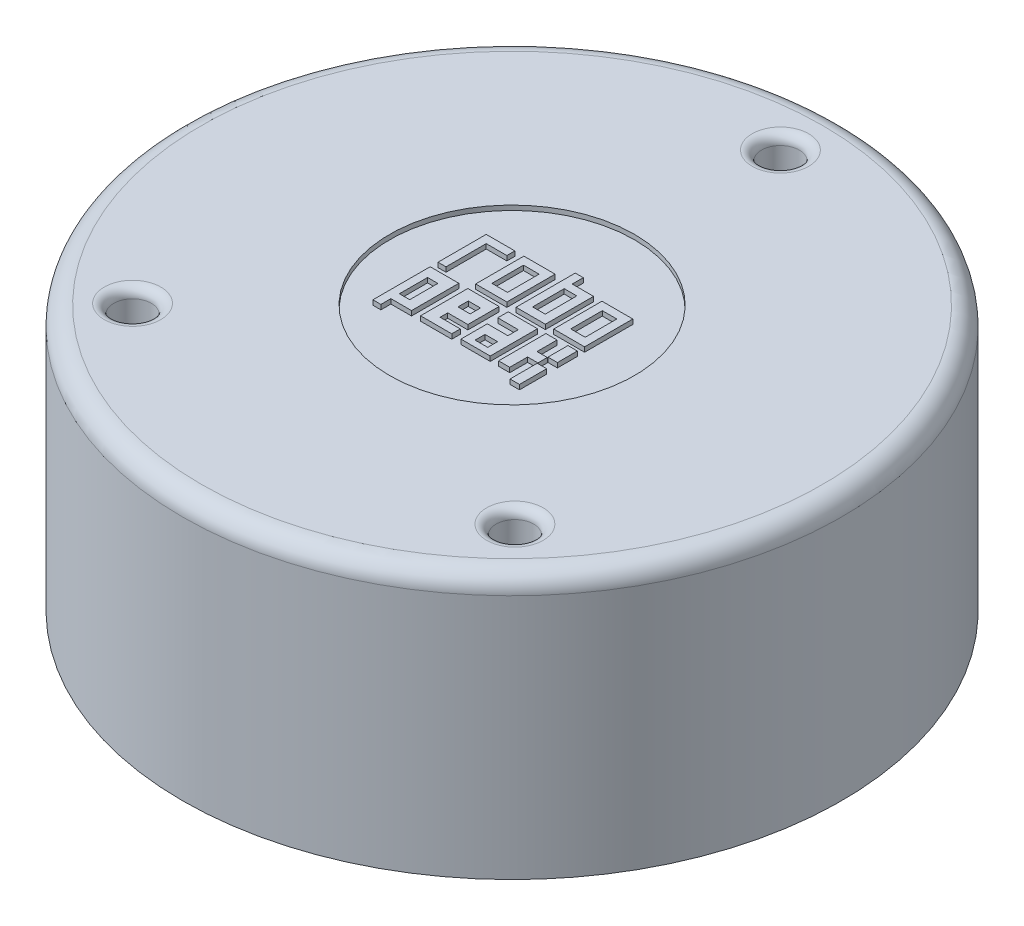
from build123d import *

# Parameters (mm, degrees)
SKETCH_1_W              = 98.5
SKETCH_1_H              = 70
EXTRUDE_1_DEPTH         = 5
SKETCH_2_R              = 35
EXTRUDE_2_DEPTH         = 28.1
SKETCH_3_R              = 2
CUT_EXTRUDE_1_DEPTH     = 5
FILLET_1_R              = 2
FILLET_2_R              = 1
SKETCH_4_R              = 13
SKETCH_4_W              = 3.316540618
SKETCH_4_H              = 5.120069114
SKETCH_4_W_2            = 3.276095001
SKETCH_4_W_3            = 1.001370982
SKETCH_4_H_2            = 2.121481923
SKETCH_4_H_3            = 2.893302243
SKETCH_4_W_4            = 1.096399653
SKETCH_4_H_4            = 2.99297568
SKETCH_4_W_5            = 1.536933457
SKETCH_4_H_5            = 3.356986235
SKETCH_4_W_6            = 1.658270309
SKETCH_4_W_7            = 1.334705371
SKETCH_4_H_6            = 1.05158605
SKETCH_4_W_8            = 1.294259754
SKETCH_4_H_7            = 1.092031667
CUT_EXTRUDE_3_DEPTH     = 0.5
SKETCH_5_R              = 1.25
CUT_EXTRUDE_4_DEPTH     = 5
SKETCH_6_R              = 9
EXTRUDE_3_DEPTH         = 7
CUT_EXTRUDE_START       = -1
SKETCH_7_R              = 9
SKETCH_7_R_2            = 0.99350654
CUT_EXTRUDE_5_DEPTH     = 1
SKETCH_8_R              = 5.521677929
SKETCH_8_R_2            = 3.001097475
CUT_EXTRUDE_6_DEPTH     = 1
FILLET_3_R              = 0.4
SKETCH_9_R              = 16
EXTRUDE_4_DEPTH         = 27
EXTRUDE_5_DEPTH         = 38
SKETCH_11_R             = 26
EXTRUDE_6_DEPTH         = 8
FILLET_4_R              = 1
SKETCH_12_W             = 106.251501727
SKETCH_12_H             = 75.565901032
CUT_EXTRUDE_7_DEPTH     = 8
FILLET_5_R              = 100
EXTRUDE_START           = 8
EXTRUDE_7_DEPTH         = 1.6
SKETCH_14_W             = 20
SKETCH_14_H             = 5
EXTRUDE_8_DEPTH         = 6
CHAMFER_1_SIZE          = 1
CUT_EXTRUDE2_DEPTH      = 72.379972525
CUT_EXTRUDE2_DEPTH_BACK = 72.379972525
SKETCH2_W               = 111.591182267
SKETCH2_H               = 43
SKETCH3_R               = 9
CUT_EXTRUDE3_DEPTH      = 10


with BuildPart() as part:
    # Эскиз1 → Бобышка-Вытянуть1 (new body)
    with BuildSketch(Plane(origin=(0, 0, 0), x_dir=(1, 0, 0), z_dir=(0, 1, 0))):
        Rectangle(SKETCH_1_W, SKETCH_1_H)
    extrude(amount=EXTRUDE_1_DEPTH)

    # Эскиз2 → Бобышка-Вытянуть2 (add)
    with BuildSketch(Plane(origin=(0, 5, 0), x_dir=(1, 0, 0), z_dir=(0, 1, 0))):
        with Locations(Location((-14.25, 0, 0), (0, 0, 270))):
            Circle(SKETCH_2_R)
    extrude(amount=EXTRUDE_2_DEPTH)

    # Эскиз3 → Вырез-Вытянуть1 (cut)
    with BuildSketch(Plane(origin=(0, 33.1, 0), x_dir=(1, 0, 0), z_dir=(0, 1, 0))):
        with Locations(Location((-14.25, 28.5, 0), (0, 0, 270))):
            Circle(SKETCH_3_R)
        with Locations(Location((-34.553940504, -20, 0), (0, 0, 270))):
            Circle(SKETCH_3_R)
        with Locations(Location((6.053940504, -20, 0), (0, 0, 270))):
            Circle(SKETCH_3_R)
    extrude(amount=-CUT_EXTRUDE_1_DEPTH, mode=Mode.SUBTRACT)

    # Скругление1
    fillet_1_edges = [part.edges().sort_by_distance(p)[0] for p in [
        (-14.25, 33.1, -35),
    ]]
    fillet(fillet_1_edges, radius=FILLET_1_R)

    # Скругление2
    fillet_2_edges = [part.edges().sort_by_distance(p)[0] for p in [
        (-14.25, 33.1, -30.5),
        (-34.553940504, 33.1, 18),
        (6.053940504, 33.1, 18),
    ]]
    fillet(fillet_2_edges, radius=FILLET_2_R)

    # Эскиз4 → Вырез-Вытянуть3 (cut)
    # profile 1 of 7: a face of its own
    with BuildSketch(Plane(origin=(0, 33.1, 0), x_dir=(1, 0, 0), z_dir=(0, 1, 0))):
        with Locations(Location((-14.25, 0, 0), (0, 0, 270))):
            Circle(SKETCH_4_R)
        Polygon((-22.115166942, -6.914876839), (-22.115166942, -0.831627154), (-19.0735421, -0.831627154), (-19.0735421, -5.853844917), (-21.266341405, -5.853844917), (-21.266341405, -6.914876839), align=None, mode=Mode.SUBTRACT)
        Polygon((-22.115166942, 0), (-22.115166942, 5.120069114), (-19.0735421, 5.120069114), (-19.0735421, 4.27071115), (-21.266341405, 4.27071115), (-21.266341405, 0), align=None, mode=Mode.SUBTRACT)
        Polygon((-13.829606569, 0), (-13.829606569, 6.292992015), (-12.980248606, 6.292992015), (-12.980248606, 5.120069114), (-10.715294037, 5.120069114), (-10.715294037, 0), align=None, mode=Mode.SUBTRACT)
        with Locations((-16.458571693, 2.560034557)):
            Rectangle(SKETCH_4_W, SKETCH_4_H, mode=Mode.SUBTRACT)
        with Locations((-8.187442955, 2.560034557)):
            Rectangle(SKETCH_4_W_2, SKETCH_4_H, mode=Mode.SUBTRACT)
        with Locations((-7.050080946, -1.825090787)):
            Rectangle(SKETCH_4_W_3, SKETCH_4_H_2, mode=Mode.SUBTRACT)
        with Locations((-7.050080946, -5.468225718)):
            Rectangle(SKETCH_4_W_3, SKETCH_4_H_3, mode=Mode.SUBTRACT)
        Polygon((-9.825490456, -0.831627154), (-8.643651064, -0.831627154), (-8.643651064, -2.960833634), (-7.550766437, -2.960833634), (-7.550766437, -3.957287265), (-8.643651064, -3.957287265), (-8.643651064, -5.853844917), (-9.825490456, -5.853844917), align=None, mode=Mode.SUBTRACT)
        Polygon((-13.829606569, -0.831627154), (-10.715294037, -0.831627154), (-10.715294037, -5.853844917), (-13.829606569, -5.853844917), (-13.829606569, -3.04994558), (-11.645543235, -3.04994558), (-11.645543235, -1.940786367), (-13.829606569, -1.940786367), align=None, mode=Mode.SUBTRACT)
        Polygon((-18.116842002, -0.831627154), (-14.800301384, -0.831627154), (-14.800301384, -4.141977247), (-16.943919101, -4.141977247), (-16.943919101, -4.950889593), (-14.800301384, -4.950889593), (-14.800301384, -5.853844917), (-18.116842002, -5.853844917), align=None, mode=Mode.SUBTRACT)
    # profile 2 of 7: a face of its own
    with BuildSketch(Plane(origin=(0, 33.1, 0), x_dir=(1, 0, 0), z_dir=(0, 1, 0))):
        with Locations((-20.718141579, -3.454401753)):
            Rectangle(SKETCH_4_W_4, SKETCH_4_H_4)
    # profile 3 of 7: a face of its own
    with BuildSketch(Plane(origin=(0, 33.1, 0), x_dir=(1, 0, 0), z_dir=(0, 1, 0))):
        with Locations((-8.167220148, 2.592218033)):
            Rectangle(SKETCH_4_W_5, SKETCH_4_H_5)
    # profile 4 of 7: a face of its own
    with BuildSketch(Plane(origin=(0, 33.1, 0), x_dir=(1, 0, 0), z_dir=(0, 1, 0))):
        with Locations((-16.478794502, 2.592218033)):
            Rectangle(SKETCH_4_W_6, SKETCH_4_H_5)
    # profile 5 of 7: a face of its own
    with BuildSketch(Plane(origin=(0, 33.1, 0), x_dir=(1, 0, 0), z_dir=(0, 1, 0))):
        with Locations((-12.312895921, 2.592218033)):
            Rectangle(SKETCH_4_W_7, SKETCH_4_H_5)
    # profile 6 of 7: a face of its own
    with BuildSketch(Plane(origin=(0, 33.1, 0), x_dir=(1, 0, 0), z_dir=(0, 1, 0))):
        with Locations((-12.312895921, -4.667770272)):
            Rectangle(SKETCH_4_W_7, SKETCH_4_H_6)
    # profile 7 of 7: a face of its own
    with BuildSketch(Plane(origin=(0, 33.1, 0), x_dir=(1, 0, 0), z_dir=(0, 1, 0))):
        with Locations((-16.296789224, -2.503929746)):
            Rectangle(SKETCH_4_W_8, SKETCH_4_H_7)
    extrude(amount=-CUT_EXTRUDE_3_DEPTH, mode=Mode.SUBTRACT)

    # Эскиз5 → Вырез-Вытянуть4 (cut)
    with BuildSketch(Plane(origin=(0, 5, 0), x_dir=(1, 0, 0), z_dir=(0, 1, 0))):
        with Locations(Location((-42.25, 28, 0), (0, 0, 270))):
            Circle(SKETCH_5_R)
        with Locations(Location((27.75, 20, 0), (0, 0, 270))):
            Circle(SKETCH_5_R)
        with Locations(Location((27.75, -20, 0), (0, 0, 90))):
            Circle(SKETCH_5_R)
        with Locations(Location((-42.25, -28, 0), (0, 0, 90))):
            Circle(SKETCH_5_R)
    extrude(amount=-CUT_EXTRUDE_4_DEPTH, mode=Mode.SUBTRACT)

    # Эскиз6 → Бобышка-Вытянуть3 (add)
    with BuildSketch(Plane(origin=(0, 5, 0), x_dir=(1, 0, 0), z_dir=(0, 1, 0))):
        with Locations(Location((31.25, 0, 0), (0, 0, 270))):
            Circle(SKETCH_6_R)
    extrude(amount=EXTRUDE_3_DEPTH)

    # Эскиз7 → Вырез-Вытянуть5 (cut)
    with BuildSketch(Plane(origin=(0, 12, 0), x_dir=(1, 0, 0), z_dir=(0, 1, 0)).offset(CUT_EXTRUDE_START)):
        with Locations(Location((31.25, 0, 0), (0, 0, 270))):
            Circle(SKETCH_7_R)
        with Locations(Location((31.25, 0, 0), (0, 0, 270))):
            Circle(SKETCH_7_R_2, mode=Mode.SUBTRACT)
    extrude(amount=CUT_EXTRUDE_5_DEPTH, mode=Mode.SUBTRACT)

    # Эскиз8 → Вырез-Вытянуть6 (cut)
    with BuildSketch(Plane(origin=(0, 11, 0), x_dir=(1, 0, 0), z_dir=(0, 1, 0))):
        with Locations(Location((31.25, 0, 0), (0, 0, 270))):
            Circle(SKETCH_8_R)
        with Locations(Location((31.25, 0, 0), (0, 0, 270))):
            Circle(SKETCH_8_R_2, mode=Mode.SUBTRACT)
    extrude(amount=-CUT_EXTRUDE_6_DEPTH, mode=Mode.SUBTRACT)

    # Скругление3
    fillet_3_edges = [part.edges().sort_by_distance(p)[0] for p in [
        (31.25, 12, -0.99350654),
    ]]
    fillet(fillet_3_edges, radius=FILLET_3_R)

    # Эскиз9 → Бобышка-Вытянуть4 (add)
    with BuildSketch(Plane(origin=(0, 5, 0), x_dir=(1, 0, 0), z_dir=(0, 1, 0))):
        with Locations(Location((31.25, 0, 0), (0, 0, 270))):
            Circle(SKETCH_9_R)
    extrude(amount=-EXTRUDE_4_DEPTH)

    # Эскиз10 → Бобышка-Вытянуть5 (add)
    with BuildSketch(Plane.XZ):
        Polygon((-40.854614908, 25.472900125), (-39.363774764, 27.944889), (-40.759159856, 30.471988875), (-43.645385092, 30.527099875), (-45.136225236, 28.055111), (-43.740840144, 25.528011125), align=None)
        Polygon((29.257133708, 22.462088812), (26.371335397, 22.536260484), (24.864201688, 20.074171672), (26.242866292, 17.537911188), (29.128664603, 17.463739516), (30.635798312, 19.925828328), align=None)
        Polygon((30.635798312, -19.925828328), (29.257133708, -22.462088812), (26.371335397, -22.536260484), (24.864201688, -20.074171672), (26.242866292, -17.537911188), (29.128664603, -17.463739516), align=None)
        Polygon((-43.740840144, -25.528011125), (-40.854614908, -25.472900125), (-39.363774764, -27.944889), (-40.759159856, -30.471988875), (-43.645385092, -30.527099875), (-45.136225236, -28.055111), align=None)
    extrude(amount=EXTRUDE_5_DEPTH)

    # Эскиз11 → Бобышка-Вытянуть6 (add)
    with BuildSketch(Plane(origin=(0, 5, 0), x_dir=(1, 0, 0), z_dir=(0, 1, 0))):
        with Locations(Location((-14.25, 0, 0), (0, 0, 270))):
            Circle(SKETCH_11_R)
    extrude(amount=-EXTRUDE_6_DEPTH)

    # Скругление4
    fillet_4_edges = [part.edges().sort_by_distance(p)[0] for p in [
        (-14.25, -3, -26),
    ]]
    fillet(fillet_4_edges, radius=FILLET_4_R)

    # Эскиз12 → Вырез-Вытянуть7 (cut)
    with BuildSketch(Plane(origin=(0, 5, 0), x_dir=(1, 0, 0), z_dir=(0, 1, 0))):
        with Locations((-0.925367694, -0.052186396)):
            Rectangle(SKETCH_12_W, SKETCH_12_H)
        with BuildLine():
            ThreePointArc((-49.25, 0), (-48.116981176, 14.083966884), (-45.528607092, 27.974329531))
            ThreePointArc((-45.528607092, 27.974329531), (-44.561596332, 29.769996926), (-42.834972324, 30.855492545))
            ThreePointArc((-42.834972324, 30.855492545), (2.249574036, 33.221442581), (42.908955543, 13.599293477))
            ThreePointArc((42.908955543, 13.599293477), (47.577997957, 7.498372972), (49.25, 0))
            ThreePointArc((49.25, 0), (47.577997957, -7.498372972), (42.908955543, -13.599293477))
            ThreePointArc((42.908955543, -13.599293477), (2.249574036, -33.221442581), (-42.834972324, -30.855492545))
            ThreePointArc((-42.834972324, -30.855492545), (-44.561596332, -29.769996926), (-45.528607092, -27.974329531))
            ThreePointArc((-45.528607092, -27.974329531), (-48.116981176, -14.083966884), (-49.25, 0))
        make_face(mode=Mode.SUBTRACT)
    extrude(amount=-CUT_EXTRUDE_7_DEPTH, mode=Mode.SUBTRACT)

    # Скругление5
    # the kernel refuses this fillet: 100 mm, written as the material it takes off along each edge
    with BuildSketch(Plane(origin=(-49.25, 5, 0), x_dir=(0.06766370453174418, 0, 0.9977081853372963), z_dir=(0, -1, 0))) as fillet_5_piece_1:
        with BuildLine():
            CenterArc((6.776645039, -99.922318338), FILLET_5_R, 87.741474483, 12.276669201)
            ThreePointArc((-10.619357471, -1.44704684), (-5.323940761, -0.618859533), (0, 0))
            ThreePointArc((0, 0), (5.358747467, 0.105631125), (10.717494933, 0))
        make_face()
    extrude(amount=31.793737334, mode=Mode.SUBTRACT)

    # Эскиз13 → Бобышка-Вытянуть7 (add)
    with BuildSketch(Plane.XZ.offset(EXTRUDE_START)):
        with BuildLine():
            Line((31.553634402, 21.860321538), (31.553634402, 16.4))
            ThreePointArc((31.553634402, 16.4), (15.153634402, 0), (31.553634402, -16.4))
            Line((31.553634402, -16.4), (31.553634402, -21.860321538))
            ThreePointArc((31.553634402, -21.860321538), (-4.596615235, -34.347840749), (-42.683124513, -30.855492545))
            ThreePointArc((-42.683124513, -30.855492545), (-44.409748521, -29.769996926), (-45.37675928, -27.974329531))
            ThreePointArc((-45.37675928, -27.974329531), (-47.965133365, -14.083966884), (-49.098152188, 0))
            ThreePointArc((-49.098152188, 0), (-47.965133365, 14.083966884), (-45.37675928, 27.974329531))
            ThreePointArc((-45.37675928, 27.974329531), (-44.409748521, 29.769996926), (-42.683124513, 30.855492545))
            ThreePointArc((-42.683124513, 30.855492545), (-4.596615235, 34.347840749), (31.553634402, 21.860321538))
        make_face()
    extrude(amount=EXTRUDE_7_DEPTH)

    # Эскиз14 → Бобышка-Вытянуть8 (add)
    with BuildSketch(Plane.XZ.offset(9.6)):
        with Locations((-14.098152188, 27.5)):
            Rectangle(SKETCH_14_W, SKETCH_14_H)
    extrude(amount=EXTRUDE_8_DEPTH)

    # Фаска1
    chamfer_1_edges = [part.edges().sort_by_distance(p)[0] for p in [
        (-24.098152188, -12.6, 30),
    ]]
    chamfer(chamfer_1_edges, length=CHAMFER_1_SIZE)

    # Sketch2 → Cut-Extrude2 (cut, two sides: drawn at the far end of the back side and taken through both)
    with BuildSketch(Plane(origin=(0, 0, 0), x_dir=(0, 0, -1), z_dir=(1, 0, 0)).offset(-CUT_EXTRUDE2_DEPTH_BACK)):
        with Locations((2.122519623, -16.5)):
            Rectangle(SKETCH2_W, SKETCH2_H)
    extrude(amount=CUT_EXTRUDE2_DEPTH + CUT_EXTRUDE2_DEPTH_BACK, mode=Mode.SUBTRACT)


with BuildPart() as cut_extrude2_piece_1:
    # of the separate pieces the step leaves, piece 1, a body of its own (cut_extrude2_pieces)
    add(part.part.solids().sort_by_distance((-14.25, 5, 35))[0])


with BuildPart() as cut_extrude2_piece_2:
    # of the separate pieces the step leaves, piece 2, a body of its own (cut_extrude2_pieces)
    add(part.part.solids().sort_by_distance((31.25, 5, 9))[0])

    # Sketch3 → Cut-Extrude3 (cut)
    with BuildSketch(Plane.XZ.offset(-5)):
        with Locations((31.25, 0)):
            Circle(SKETCH3_R)
    extrude(amount=-CUT_EXTRUDE3_DEPTH, mode=Mode.SUBTRACT)


solid = cut_extrude2_piece_1.part
